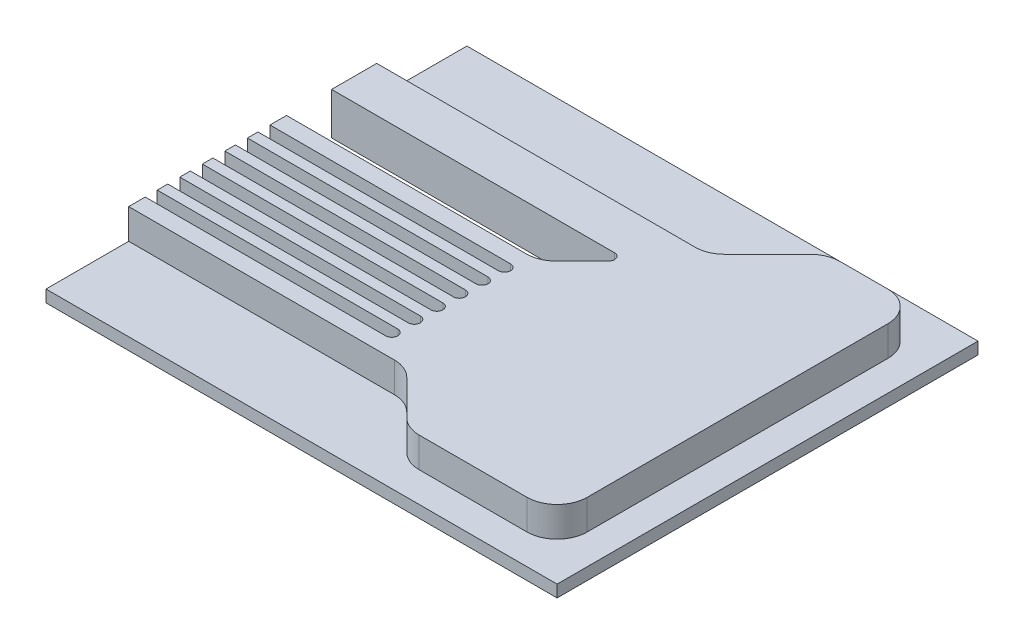
from build123d import *
from build123d.topology import SkipClean

# Parameters (mm, degrees)
SKETCH1_W               = 170
SKETCH1_H               = 140
BOSS_EXTRUDE1_DEPTH     = 4
BOSS_EXTRUDE2_DEPTH     = 10
CUT_EXTRUDE3_DEPTH      = 221.671701856
CUT_EXTRUDE3_DEPTH_BACK = 221.671701856
CUT_EXTRUDE6_DEPTH      = 10


with BuildPart() as part:
    # Sketch1 → Boss-Extrude1 (new body)
    with BuildSketch(Plane(origin=(0, 0, 0), x_dir=(1, 0, 0), z_dir=(0, 1, 0))):
        with Locations((85, 70)):
            Rectangle(SKETCH1_W, SKETCH1_H)
    extrude(amount=BOSS_EXTRUDE1_DEPTH)

    # Sketch2 → Boss-Extrude2 (add)
    with BuildSketch(Plane(origin=(0, 4, 0), x_dir=(1, 0, 0), z_dir=(0, 1, 0))):
        with BuildLine():
            Line((127.071067812, 127.071067812), (112.928932188, 112.928932188))
            ThreePointArc((112.928932188, 112.928932188), (109.6846987, 110.761204675), (105.857864376, 110))
            Line((105.857864376, 110), (0, 110))
            Line((0, 110), (0, 95))
            Line((0, 95), (94.092172608, 95))
            ThreePointArc((94.092172608, 95), (95.939931673, 93.765366865), (95.50638617, 91.585786438))
            Line((95.50638617, 91.585786438), (86.849531921, 82.928932188))
            ThreePointArc((86.849531921, 82.928932188), (83.605298432, 80.761204675), (79.778464109, 80))
            Line((79.778464109, 80), (30.446951372, 80))
            Line((30.446951372, 80), (0, 80))
            Line((0, 80), (0, 74.5))
            Line((0, 74.5), (80, 74.5))
            ThreePointArc((80, 74.5), (82, 72.5), (80, 70.5))
            Line((80, 70.5), (0, 70.5))
            Line((0, 70.5), (0, 67))
            Line((0, 67), (80, 67))
            ThreePointArc((80, 67), (82, 65), (80, 63))
            Line((80, 63), (0, 63))
            Line((0, 63), (0, 59.5))
            Line((0, 59.5), (80, 59.5))
            ThreePointArc((80, 59.5), (82, 57.5), (80, 55.5))
            Line((80, 55.5), (0, 55.5))
            Line((0, 55.5), (0, 52))
            Line((0, 52), (80, 52))
            ThreePointArc((80, 52), (82, 50), (80, 48))
            Line((80, 48), (0, 48))
            Line((0, 48), (0, 44.5))
            Line((0, 44.5), (80, 44.5))
            ThreePointArc((80, 44.5), (82, 42.5), (80, 40.5))
            Line((80, 40.5), (0, 40.5))
            Line((0, 40.5), (0, 37))
            Line((0, 37), (80, 37))
            ThreePointArc((80, 37), (82, 35), (80, 33))
            Line((80, 33), (0, 33))
            Line((0, 33), (0, 27.5))
            Line((0, 27.5), (88.357864376, 27.5))
            ThreePointArc((88.357864376, 27.5), (92.1846987, 26.738795325), (95.428932188, 24.571067812))
            Line((95.428932188, 24.571067812), (107.071067812, 12.928932188))
            ThreePointArc((107.071067812, 12.928932188), (110.3153013, 10.761204675), (114.142135624, 10))
            Line((114.142135624, 10), (150, 10))
            ThreePointArc((150, 10), (157.071067812, 12.928932188), (160, 20))
            Line((160, 20), (160, 120))
            ThreePointArc((160, 120), (157.071067812, 127.071067812), (150, 130))
            Line((150, 130), (134.142135624, 130))
            ThreePointArc((134.142135624, 130), (130.3153013, 129.238795325), (127.071067812, 127.071067812))
        make_face()
    extrude(amount=BOSS_EXTRUDE2_DEPTH)

    # Sketch4 → Cut-Extrude3 (cut, two sides: drawn at the far end of the back side and taken through both)
    with SkipClean():  # the faces are left unmerged after this step: merging them gives an invalid solid
        with BuildSketch(Plane(origin=(0, 0, 0), x_dir=(1, 0, 0), z_dir=(0, 1, 0)).offset(-CUT_EXTRUDE3_DEPTH_BACK)):
            with BuildLine():
                Line((94.092172608, 95), (0, 95))
                Line((0, 95), (0, 80))
                Line((0, 80), (30.446951372, 80))
                Line((30.446951372, 80), (79.778464109, 80))
                ThreePointArc((79.778464109, 80), (83.605298432, 80.761204675), (86.849531921, 82.928932188))
                Line((86.849531921, 82.928932188), (95.50638617, 91.585786438))
                ThreePointArc((95.50638617, 91.585786438), (95.939931673, 93.765366865), (94.092172608, 95))
            make_face()
        extrude(amount=CUT_EXTRUDE3_DEPTH + CUT_EXTRUDE3_DEPTH_BACK, mode=Mode.SUBTRACT)
    add(part.part.scale(1), mode=Mode.REPLACE)  # the faces are merged on a copy

    # Sketch5 → Cut-Extrude6 (cut)
    with BuildSketch(Plane(origin=(0, 0, 0), x_dir=(1, 0, 0), z_dir=(0, 1, 0))):
        with BuildLine():
            Line((-80, 70.5), (80, 70.5))
            ThreePointArc((80, 70.5), (82, 72.5), (80, 74.5))
            Line((80, 74.5), (-80, 74.5))
            ThreePointArc((-80, 74.5), (-82, 72.5), (-80, 70.5))
        make_face()
        with BuildLine():
            Line((80, 63), (-80, 63))
            ThreePointArc((-80, 63), (-82, 65), (-80, 67))
            Line((-80, 67), (80, 67))
            ThreePointArc((80, 67), (82, 65), (80, 63))
        make_face()
        with BuildLine():
            Line((-80, 55.5), (80, 55.5))
            ThreePointArc((80, 55.5), (82, 57.5), (80, 59.5))
            Line((80, 59.5), (-80, 59.5))
            ThreePointArc((-80, 59.5), (-82, 57.5), (-80, 55.5))
        make_face()
        with BuildLine():
            Line((-80, 48), (80, 48))
            ThreePointArc((80, 48), (82, 50), (80, 52))
            Line((80, 52), (-80, 52))
            ThreePointArc((-80, 52), (-82, 50), (-80, 48))
        make_face()
        with BuildLine():
            Line((-80, 40.5), (80, 40.5))
            ThreePointArc((80, 40.5), (82, 42.5), (80, 44.5))
            Line((80, 44.5), (-80, 44.5))
            ThreePointArc((-80, 44.5), (-82, 42.5), (-80, 40.5))
        make_face()
        with BuildLine():
            Line((-80, 33), (80, 33))
            ThreePointArc((80, 33), (82, 35), (80, 37))
            Line((80, 37), (-80, 37))
            ThreePointArc((-80, 37), (-82, 35), (-80, 33))
        make_face()
    extrude(amount=CUT_EXTRUDE6_DEPTH, mode=Mode.SUBTRACT)


solid = part.part
